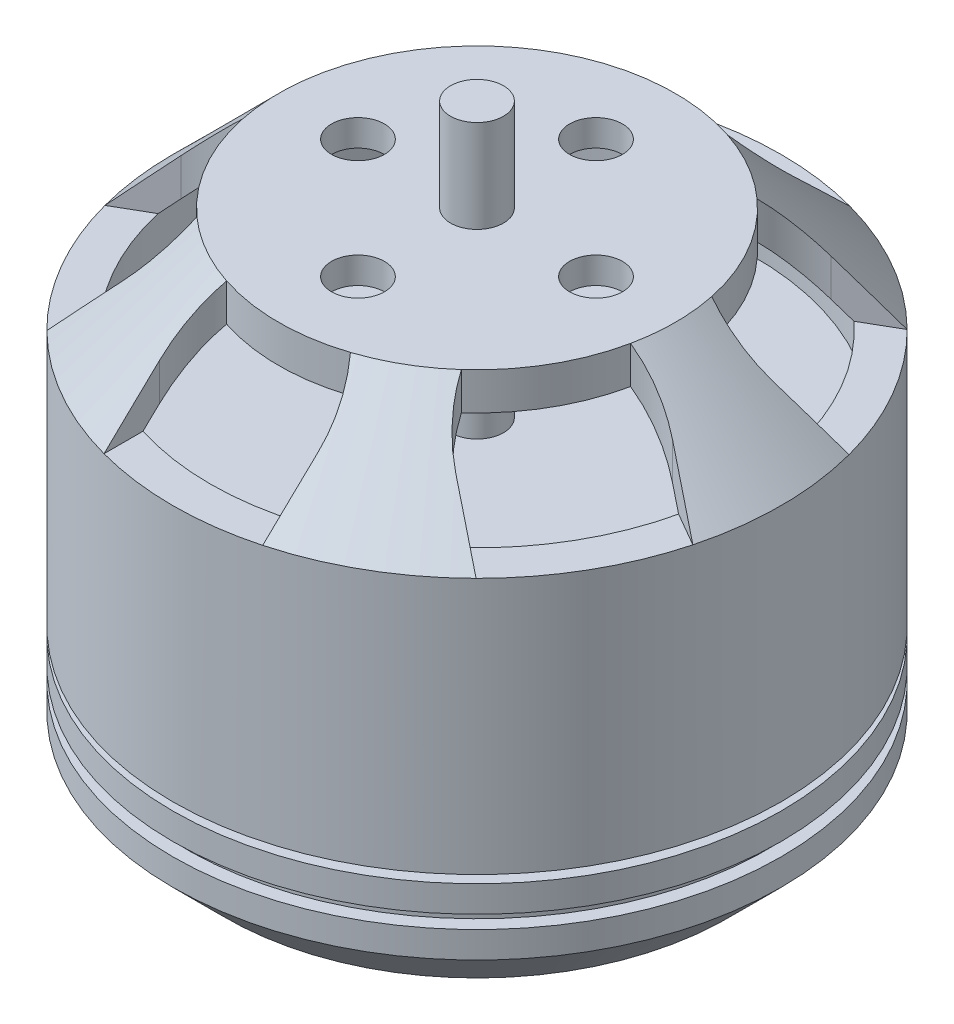
from build123d import *

# Parameters (mm, degrees)
SKETCH2_R          = 1
CUT_EXTRUDE1_DEPTH = 4
SKETCH3_R          = 1
CUT_EXTRUDE2_DEPTH = 3


with BuildPart() as part:
    # Sketch1 → Revolve1 (revolve)
    with BuildSketch(Plane.XY):
        Polygon((0, 22), (0, -1.8), (1, -1.8), (1, 0), (9.5, 0), (11.5, 2), (11.5, 3), (11, 3), (11, 3.5), (11.5, 3.5), (11.5, 4.5), (9.5, 4.5), (9.5, 4.8), (11.5, 4.8), (11.5, 14.5), (7.5, 18.5), (1, 18.5), (1, 22), align=None)
        Polygon((2, 17.5), (7.085786438, 17.5), (10.5, 14.085786438), (10.5, 11.635505843), (1, 11.635505843), (1, 16.5), (2, 16.5), align=None, mode=Mode.SUBTRACT)
    revolve(axis=Axis((0, 22, 0), (0, -1, 0)))

    # Sketch2 → Cut-Extrude1 (cut)
    with BuildSketch(Plane(origin=(0, 18.5, 0), x_dir=(1, 0, 0), z_dir=(0, 1, 0))):
        with BuildLine():
            Line((-3, 14.723214578), (-3, 9))
            ThreePointArc((-3, 9), (-2.830690971, 8.006426336), (-2.341874249, 7.125))
            ThreePointArc((-2.341874249, 7.125), (0, 7.5), (2.341874249, 7.125))
            ThreePointArc((2.341874249, 7.125), (2.830690971, 8.006426336), (3, 9))
            Line((3, 9), (3, 14.723214578))
            Line((3, 14.723214578), (-3, 14.723214578))
        make_face()
        with BuildLine():
            ThreePointArc((-7.341368127, 1.534377408), (-6.495190528, 3.75), (-4.999493877, 5.590622592))
            ThreePointArc((-4.999493877, 5.590622592), (-5.518423115, 6.454663459), (-6.294228634, 7.098076211))
            Line((-6.294228634, 7.098076211), (-11.25067785, 9.9596835))
            Line((-11.25067785, 9.9596835), (-14.25067785, 4.763531077))
            Line((-14.25067785, 4.763531077), (-9.294228634, 1.901923789))
            ThreePointArc((-9.294228634, 1.901923789), (-8.349114086, 1.551762877), (-7.341368127, 1.534377408))
        make_face()
        with BuildLine():
            ThreePointArc((6.294228634, 7.098076211), (5.518423115, 6.454663459), (4.999493877, 5.590622592))
            ThreePointArc((4.999493877, 5.590622592), (6.495190528, 3.75), (7.341368127, 1.534377408))
            ThreePointArc((7.341368127, 1.534377408), (8.349114086, 1.551762877), (9.294228634, 1.901923789))
            Line((9.294228634, 1.901923789), (14.25067785, 4.763531077))
            Line((14.25067785, 4.763531077), (11.25067785, 9.9596835))
            Line((11.25067785, 9.9596835), (6.294228634, 7.098076211))
        make_face()
        with BuildLine():
            ThreePointArc((-4.999493877, -5.590622592), (-6.495190528, -3.75), (-7.341368127, -1.534377408))
            ThreePointArc((-7.341368127, -1.534377408), (-8.349114086, -1.551762877), (-9.294228634, -1.901923789))
            Line((-9.294228634, -1.901923789), (-14.25067785, -4.763531077))
            Line((-14.25067785, -4.763531077), (-11.25067785, -9.9596835))
            Line((-11.25067785, -9.9596835), (-6.294228634, -7.098076211))
            ThreePointArc((-6.294228634, -7.098076211), (-5.518423115, -6.454663459), (-4.999493877, -5.590622592))
        make_face()
        with BuildLine():
            ThreePointArc((9.294228634, -1.901923789), (8.349114086, -1.551762877), (7.341368127, -1.534377408))
            ThreePointArc((7.341368127, -1.534377408), (6.495190528, -3.75), (4.999493877, -5.590622592))
            ThreePointArc((4.999493877, -5.590622592), (5.518423115, -6.454663459), (6.294228634, -7.098076211))
            Line((6.294228634, -7.098076211), (11.25067785, -9.9596835))
            Line((11.25067785, -9.9596835), (14.25067785, -4.763531077))
            Line((14.25067785, -4.763531077), (9.294228634, -1.901923789))
        make_face()
        with BuildLine():
            ThreePointArc((2.341874249, -7.125), (0, -7.5), (-2.341874249, -7.125))
            ThreePointArc((-2.341874249, -7.125), (-2.830690971, -8.006426336), (-3, -9))
            Line((-3, -9), (-3, -14.723214578))
            Line((-3, -14.723214578), (3, -14.723214578))
            Line((3, -14.723214578), (3, -9))
            ThreePointArc((3, -9), (2.830690971, -8.006426336), (2.341874249, -7.125))
        make_face()
        with Locations((0, 4.5)):
            Circle(SKETCH2_R)
        with Locations((4.5, 0)):
            Circle(SKETCH2_R)
        with Locations((0, -4.5)):
            Circle(SKETCH2_R)
        with Locations((-4.5, 0)):
            Circle(SKETCH2_R)
    extrude(amount=-CUT_EXTRUDE1_DEPTH, mode=Mode.SUBTRACT)

    # Sketch3 → Cut-Extrude2 (cut)
    with BuildSketch(Plane.XZ):
        with Locations((0, 6)):
            Circle(SKETCH3_R)
        with Locations((0, -6)):
            Circle(SKETCH3_R)
        with Locations((8, 0)):
            Circle(SKETCH3_R)
        with Locations((-8, 0)):
            Circle(SKETCH3_R)
    extrude(amount=-CUT_EXTRUDE2_DEPTH, mode=Mode.SUBTRACT)


solid = part.part
